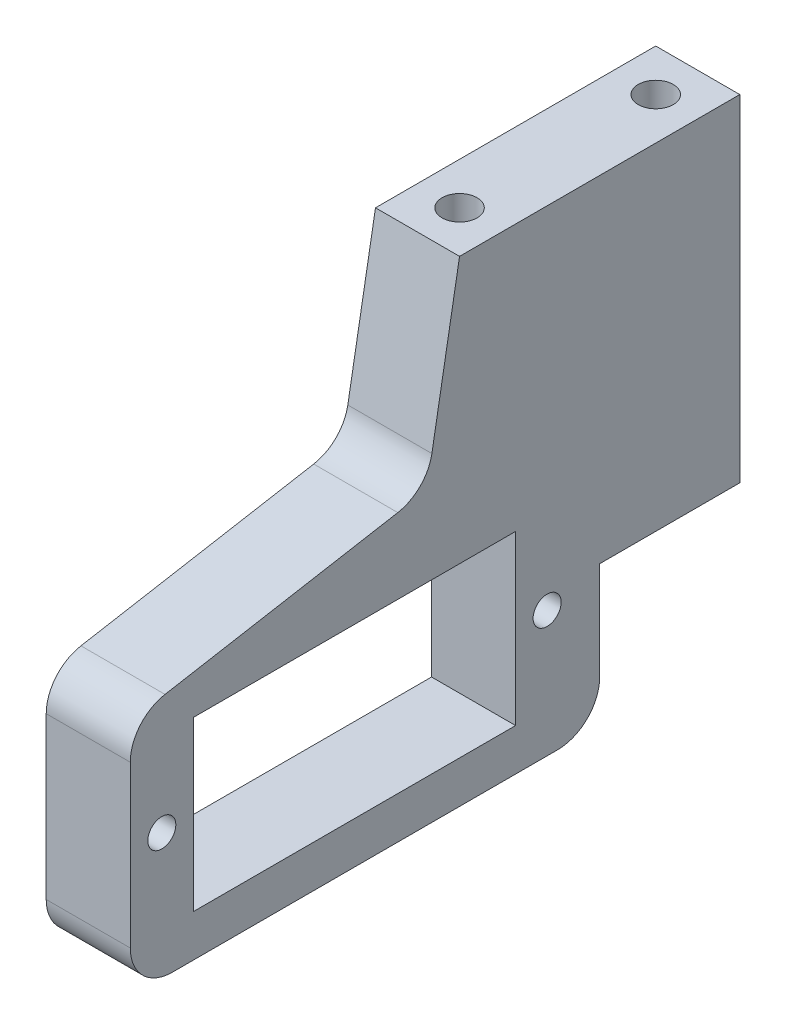
from build123d import *

# Parameters (mm, degrees)
SKETCH2_R                                 = 1
SKETCH2_W                                 = 23
SKETCH2_H                                 = 12
BOSS_EXTRUDE1_DEPTH                       = 6
CUT_EXTRUDE1_REACH                        = 57.536
SKETCH3_W                                 = 10
SKETCH3_H                                 = 10
FILLET1_R                                 = 3
TAP_DRILL_FOR_M3X0_5_TAP1_D               = 2.5
TAP_DRILL_FOR_M3X0_5_TAP1_DEPTH           = 10
TAP_DRILL_FOR_M3X0_5_TAP1_TIP             = 0.751075774
TAP_DRILL_FOR_M3X0_5_TAP1_ON_FACE_2_D     = 2.5
TAP_DRILL_FOR_M3X0_5_TAP1_ON_FACE_2_DEPTH = 10
TAP_DRILL_FOR_M3X0_5_TAP1_ON_FACE_2_TIP   = 0.751075774


with BuildPart() as part:
    # Sketch2 → Boss-Extrude1 (new body)
    with BuildSketch(Plane(origin=(0, 0, 0), x_dir=(0, 0, -1), z_dir=(1, 0, 0))):
        Polygon((-20, 0), (-22.339658165, -13.268860813), (-43.5, -17), (-43.5, -34), (0, -34), (0, 0), align=None)
        with Locations((-41.25, -25)):
            Circle(SKETCH2_R, mode=Mode.SUBTRACT)
        with Locations((-13.75, -25)):
            Circle(SKETCH2_R, mode=Mode.SUBTRACT)
        with Locations((-27.5, -25)):
            Rectangle(SKETCH2_W, SKETCH2_H, mode=Mode.SUBTRACT)
    extrude(amount=BOSS_EXTRUDE1_DEPTH)

    # Sketch3 → Cut-Extrude1 (cut, up to next)
    with BuildSketch(Plane.ZY, mode=Mode.PRIVATE) as cut_extrude1_sk1:
        with Locations((5, -29)):
            Rectangle(SKETCH3_W, SKETCH3_H)
    cut_extrude1_tool1 = extrude(cut_extrude1_sk1.sketch, amount=-CUT_EXTRUDE1_REACH, mode=Mode.PRIVATE) & part.part
    add(cut_extrude1_tool1.solids().sort_by_distance((0, -29, 5))[0], mode=Mode.SUBTRACT)

    # Fillet1
    fillet1_edges = [part.edges().sort_by_distance(p)[0] for p in [
        (3, -13.268860813, 22.339658165),
        (3, -34, 10),
        (3, -34, 43.5),
        (3, -17, 43.5),
    ]]
    fillet(fillet1_edges, radius=FILLET1_R)

    # Tap Drill for M3x0.5 Tap1
    with Locations(Plane(origin=(3, 0, 3), x_dir=(0, 0, 1), z_dir=(0, 1, 0))):
        with Locations((0, 0), (14, 0)):
            Hole(TAP_DRILL_FOR_M3X0_5_TAP1_D / 2, depth=TAP_DRILL_FOR_M3X0_5_TAP1_DEPTH)
            with Locations((0, 0, -(TAP_DRILL_FOR_M3X0_5_TAP1_DEPTH + TAP_DRILL_FOR_M3X0_5_TAP1_TIP / 2))):  # 118° drill point
                Cone(0, TAP_DRILL_FOR_M3X0_5_TAP1_D / 2, TAP_DRILL_FOR_M3X0_5_TAP1_TIP, mode=Mode.SUBTRACT)

    # Tap Drill for M3x0.5 Tap1 on face 2
    with Locations(Plane(origin=(3, -24, 5), x_dir=(0, 0, -1), z_dir=(0, -1, 0))):
        with Locations((0, 0)):
            Hole(TAP_DRILL_FOR_M3X0_5_TAP1_ON_FACE_2_D / 2, depth=TAP_DRILL_FOR_M3X0_5_TAP1_ON_FACE_2_DEPTH)
            with Locations((0, 0, -(TAP_DRILL_FOR_M3X0_5_TAP1_ON_FACE_2_DEPTH + TAP_DRILL_FOR_M3X0_5_TAP1_ON_FACE_2_TIP / 2))):  # 118° drill point
                Cone(0, TAP_DRILL_FOR_M3X0_5_TAP1_ON_FACE_2_D / 2, TAP_DRILL_FOR_M3X0_5_TAP1_ON_FACE_2_TIP, mode=Mode.SUBTRACT)


solid = part.part
